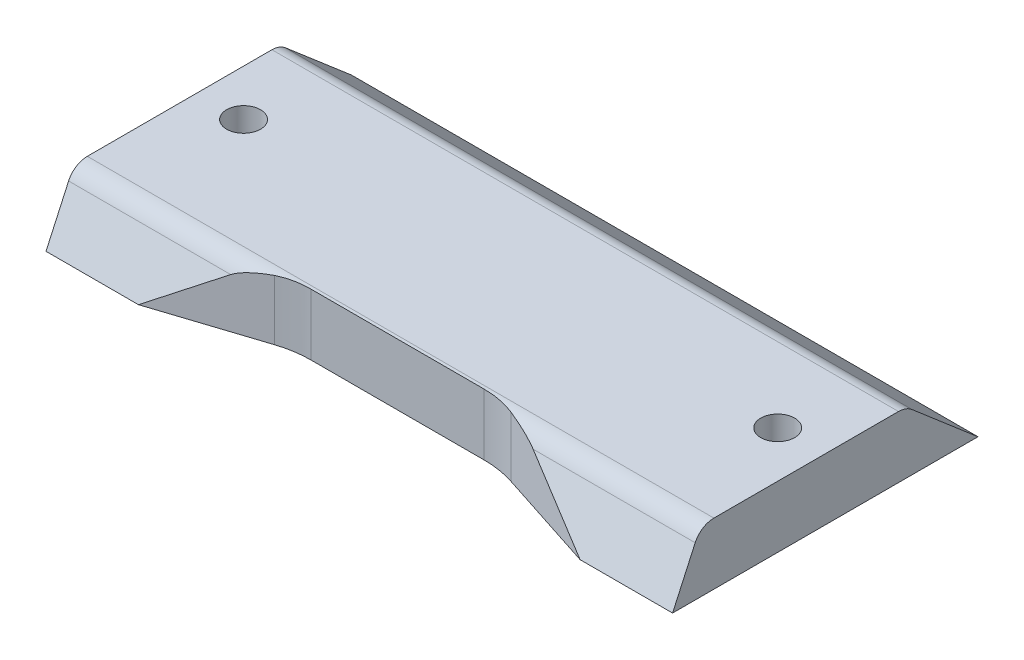
from build123d import *

# Parameters (mm, degrees)
SKETCH1_R                      = 10.999999999999991
SKETCH1_R_2                    = 1.5500000000000034
SKETCH1_R_3                    = 1.5500000000000018
SKETCH1_R_4                    = 1.5499999999999992
SKETCH1_R_5                    = 1.5500000000000012
BOSS_EXTRUDE1_DEPTH            = 2.8
SKETCH2_R                      = 1.5499999999999992
SKETCH2_R_2                    = 1.5500000000000005
SKETCH2_R_3                    = 1.5500000000000034
SKETCH2_R_4                    = 1.5500000000000018
BOSS_EXTRUDE2_DEPTH            = 8
SKETCH3_R                      = 2.75
SKETCH3_R_2                    = 2.749999999999998
SKETCH3_R_3                    = 2.7500000000000044
SKETCH3_R_4                    = 2.7500000000000036
CUT_EXTRUDE1_DEPTH             = 3.6
SKETCH4_W                      = 13.999999999999996
SKETCH4_H                      = 24
BOSS_EXTRUDE3_DEPTH            = 9
CUT_EXTRUDE3_DEPTH             = 92.05990830217213
CHAMFER1_SIZE                  = 2.4
BOSS_EXTRUDE4_START            = -21.5
BOSS_EXTRUDE4_DEPTH            = 43
SKETCH5_R                      = 1.6499999999999986
SKETCH5_R_2                    = 1.6500000000000061
CUT_EXTRUDE2_DEPTH             = 18
CUT_EXTRUDE4_DEPTH             = 2.8
CHAMFER2_SIZE                  = 1
CHAMFER3_SIZE                  = 1
FILLET1_R                      = 2
CHAMFER4_SIZE                  = 2
CHAMFER5_SIZE                  = 0.4
CHAMFER6_SIZE                  = 0.4
CUT_EXTRUDE6_REACH             = 93.06
CUT_EXTRUDE6_DIRECTION_2_DEPTH = 92.05990830217215
CUT_EXTRUDE5_DEPTH             = 92.05990830217213
CUT_EXTRUDE5_DEPTH_BACK        = 92.05990830217213
FILLET2_R                      = 10


# Read off the part's stored shape, not the designer's step: Mirror1
with BuildPart() as part:
    # Sketch1 → Boss-Extrude1 (new body)
    with BuildSketch(Plane.XY):
        Polygon((-21.499999999999996, 51), (21.499999999999996, 51), (21.5, 8), (-21.5, 8), align=None)
        with Locations((0, 29.5)):
            Circle(SKETCH1_R, mode=Mode.SUBTRACT)
        with Locations((-15.5, 45)):
            Circle(SKETCH1_R_2, mode=Mode.SUBTRACT)
        with Locations((15.5, 45)):
            Circle(SKETCH1_R_3, mode=Mode.SUBTRACT)
        with Locations((-15.5, 14.000000000000005)):
            Circle(SKETCH1_R_4, mode=Mode.SUBTRACT)
        with Locations((15.5, 14.000000000000005)):
            Circle(SKETCH1_R_5, mode=Mode.SUBTRACT)
    extrude(amount=BOSS_EXTRUDE1_DEPTH)

    # Sketch2 → Boss-Extrude2 (add)
    with BuildSketch(Plane(origin=(0, 0, 0), x_dir=(1, 0, 0), z_dir=(0, 1, 0))):
        with BuildLine():
            Line((-21.5, 0), (21.5, 0))
            Line((21.5, 0), (21.5, -56.13000000000001))
            Line((21.5, -56.13000000000001), (12.052422437019597, -62.83770289976113))
            ThreePointArc((12.052422437019597, -62.83770289976113), (10.126743955166411, -63.79910489864743), (8.000000000000245, -64.12999999999994))
            Line((8.000000000000245, -64.12999999999994), (-7.999999999999807, -64.13))
            ThreePointArc((-7.999999999999807, -64.13), (-10.126743955165974, -63.7991048986475), (-12.052422437019167, -62.83770289976122))
            Line((-12.052422437019167, -62.83770289976122), (-21.49999999999961, -56.13000000000015))
            Line((-21.49999999999961, -56.13000000000015), (-21.5, 0))
        make_face()
        with Locations(Location((8.00000000000003, -8.800000000000002, 0), (0, 0, 270))):
            Circle(SKETCH2_R, mode=Mode.SUBTRACT)
        with Locations(Location((-7.999999999999971, -8.800000000000054, 0), (0, 0, 270))):
            Circle(SKETCH2_R_2, mode=Mode.SUBTRACT)
        with Locations(Location((-7.999999999999804, -57.13000000000005, 0), (0, 0, 270))):
            Circle(SKETCH2_R_3, mode=Mode.SUBTRACT)
        with Locations(Location((8.000000000000195, -57.13, 0), (0, 0, 270))):
            Circle(SKETCH2_R_4, mode=Mode.SUBTRACT)
        with BuildLine():
            Line((15.912505911952584, -21.89324240011998), (3.312505911952694, -31.19069648889579))
            ThreePointArc((3.312505911952694, -31.19069648889579), (2.5001050442102857, -32.779502053609654), (3.2797696996303043, -34.38462551224556))
            Line((3.2797696996303043, -34.38462551224556), (15.87976969963019, -44.08717142346975))
            ThreePointArc((15.87976969963019, -44.08717142346975), (17.983045695097484, -44.297045925258715), (19.099999999999998, -42.50254591122421))
            Line((19.099999999999998, -42.50254591122421), (19.1, -23.50254591122421))
            ThreePointArc((19.1, -23.50254591122421), (18.001391098221283, -21.717190459767167), (15.912505911952584, -21.89324240011998))
        make_face(mode=Mode.SUBTRACT)
        with BuildLine():
            Line((10.520825659408167, -19.409303511104177), (1.1874940880475682, -26.2963052396794))
            ThreePointArc((1.1874940880475682, -26.2963052396794), (9.102e-14, -26.687001728575183), (-1.1874940880473879, -26.296305239679405))
            Line((-1.1874940880473879, -26.296305239679405), (-10.520825659408036, -19.40930351110425))
            ThreePointArc((-10.520825659408036, -19.40930351110425), (-11.233148275967746, -17.17494281149982), (-9.333331571360638, -15.800000000000061))
            Line((-9.333331571360638, -15.800000000000061), (9.333331571360745, -15.799999999999999))
            ThreePointArc((9.333331571360745, -15.799999999999999), (11.233148275967867, -17.17494281149974), (10.520825659408167, -19.409303511104177))
        make_face(mode=Mode.SUBTRACT)
        with BuildLine():
            Line((1.2202303003699406, -39.36175579272474), (10.553561871730695, -46.548825481280836))
            ThreePointArc((10.553561871730695, -46.548825481280836), (11.226642299225048, -48.77794652318848), (9.333331571360894, -50.13345099352635))
            Line((9.333331571360894, -50.13345099352635), (-9.33333157136048, -50.133450993526345))
            ThreePointArc((-9.33333157136048, -50.133450993526345), (-11.226642299224643, -48.7779465231885), (-10.553561871730299, -46.548825481280836))
            Line((-10.553561871730299, -46.548825481280836), (-1.2202303003696755, -39.36175579272474))
            ThreePointArc((-1.2202303003696755, -39.36175579272474), (1.3436e-13, -38.946381304970274), (1.2202303003699406, -39.36175579272474))
        make_face(mode=Mode.SUBTRACT)
        with BuildLine():
            Line((-3.2797696996300685, -34.384625512245584), (-15.879769699629884, -44.087171423469854))
            ThreePointArc((-15.879769699629884, -44.087171423469854), (-17.98304569509718, -44.297045925258836), (-19.099999999999707, -42.50254591122434))
            Line((-19.099999999999707, -42.50254591122434), (-19.099999999999834, -23.502545911224342))
            ThreePointArc((-19.099999999999834, -23.502545911224342), (-18.00139109822113, -21.71719045976729), (-15.912505911952431, -21.893242400120087))
            Line((-15.912505911952431, -21.893242400120087), (-3.31250591195248, -31.190696488895814))
            ThreePointArc((-3.31250591195248, -31.190696488895814), (-2.500105044210054, -32.779502053609676), (-3.2797696996300685, -34.384625512245584))
        make_face(mode=Mode.SUBTRACT)
    extrude(amount=BOSS_EXTRUDE2_DEPTH)

    # Sketch3 → Cut-Extrude1 (cut)
    with BuildSketch(Plane(origin=(0, 8, 0), x_dir=(1, 0, 0), z_dir=(0, 1, 0))):
        with Locations(Location((-7.999999999999971, -8.800000000000054, 0), (0, 0, 270))):
            Circle(SKETCH3_R)
        with Locations(Location((8.00000000000003, -8.800000000000002, 0), (0, 0, 270))):
            Circle(SKETCH3_R_2)
        with Locations(Location((-7.999999999999804, -57.13000000000005, 0), (0, 0, 270))):
            Circle(SKETCH3_R_3)
        with Locations(Location((8.000000000000195, -57.13, 0), (0, 0, 270))):
            Circle(SKETCH3_R_4)
    extrude(amount=-CUT_EXTRUDE1_DEPTH, mode=Mode.SUBTRACT)

    # Sketch4 → Boss-Extrude3 (add)
    # profile 1 of 2: a face of its own
    with BuildSketch(Plane(origin=(21.5, 1.73e-15, 0), x_dir=(0, 0, -1), z_dir=(1, 0, 0))):
        Polygon((-2.8, 8), (-2.8, 51), (-6.800000000000001, 51), (-13.799999999999999, 56.99999999999999), (-33.8, 57), (-56.13000000000001, 8.000000000000007), align=None)
        with Locations((-21.79999999999999, 26.999999999999993)):
            Rectangle(SKETCH4_W, SKETCH4_H, mode=Mode.SUBTRACT)
    # profile 2 of 2: a face of its own
    with BuildSketch(Plane(origin=(21.5, 1.73e-15, 0), x_dir=(0, 0, -1), z_dir=(1, 0, 0))):
        Polygon((0, 51), (-2.8, 51), (-2.8, 8), (-56.13000000000001, 8.000000000000007), (-56.13000000000001, 0), (0, 0), align=None)
    extrude(amount=BOSS_EXTRUDE3_DEPTH)

    # Sketch6 → Cut-Extrude3 (cut, through all)
    with BuildSketch(Plane.XZ):
        with BuildLine():
            Line((30.5, 56.13000000000001), (21.5, 56.13000000000001))
            Line((21.5, 56.13000000000001), (27.131339928022157, 52.13179464916522))
            ThreePointArc((27.131339928022157, 52.13179464916522), (29.60811928094123, 49.27948759313254), (30.5, 45.60870562086678))
            Line((30.5, 45.60870562086678), (30.5, 56.13000000000001))
        make_face()
    extrude(amount=-CUT_EXTRUDE3_DEPTH, mode=Mode.SUBTRACT)

    # Chamfer1
    # the kernel refuses this chamfer: 2.4 mm, written as the material it adds along each edge
    with BuildSketch(Plane(origin=(21.5, 8, 2.8), x_dir=(-0.9996219169112968, -0.027495876610586303, 0), z_dir=(0, 0, 1))) as chamfer1_piece_1_section:
        Polygon((CHAMFER1_SIZE * 0.999621916911, -CHAMFER1_SIZE * 0.0274958766106), (-CHAMFER1_SIZE * 0.0274958766106, -CHAMFER1_SIZE * 0.999621916911), (0, 0), align=None)
    chamfer1_piece_1 = extrude(amount=59.502039171118206, mode=Mode.PRIVATE)
    chamfer1_piece_1 = split(chamfer1_piece_1, bisect_by=Plane(origin=(20.6986233607906, 18.79069033848495, 51.212528260033295), z_dir=(0, -0.4146842236388121, -0.9099653810256058)), keep=Keep.TOP, mode=Mode.PRIVATE)
    add(chamfer1_piece_1)

    # Mirror1: part across plane


with BuildPart() as part_1:
    add(part.part)
    add(part.part.mirror(Plane(origin=(0, 0, 0), x_dir=(0, 0, 1), z_dir=(1, 0, 0))))

    # Sketch7 → Boss-Extrude4 (add)
    with BuildSketch(Plane(origin=(0, 0, 0), x_dir=(0, 0, -1), z_dir=(1, 0, 0)).offset(BOSS_EXTRUDE4_START)):
        Polygon((-36.53428571428571, 50.99999999999999), (-6.800000000000001, 51), (-13.799999999999999, 56.99999999999999), (-33.8, 57), align=None)
    extrude(amount=BOSS_EXTRUDE4_DEPTH)

    # Sketch5 → Cut-Extrude2 (cut)
    with BuildSketch(Plane(origin=(0, 56.999999999999986, -1.978e-14), x_dir=(1, 0, 0), z_dir=(0, 1, 0))):
        with Locations(Location((26, -21.8, 0), (0, 0, 270))):
            Circle(SKETCH5_R)
        with Locations(Location((-26, -21.8, 0), (0, 0, 270))):
            Circle(SKETCH5_R_2)
    extrude(amount=-CUT_EXTRUDE2_DEPTH, mode=Mode.SUBTRACT)

    # Sketch9 → Cut-Extrude4 (cut)
    with BuildSketch(Plane.XZ.offset(-38.99999999999999)):
        Polygon((26, 18.566838492538096), (28.800000000000004, 20.183419246269047), (28.800000000000008, 23.416580753730955), (26.00000000000001, 25.03316150746191), (23.200000000000003, 23.416580753730955), (23.2, 20.18341924626905), align=None)
        Polygon((-26, 18.566838492538096), (-28.800000000000004, 20.183419246269047), (-28.800000000000008, 23.416580753730955), (-26.00000000000001, 25.03316150746191), (-23.200000000000003, 23.416580753730955), (-23.2, 20.18341924626905), align=None)
    extrude(amount=-CUT_EXTRUDE4_DEPTH, mode=Mode.SUBTRACT)

    # Chamfer2
    chamfer2_edges = [part_1.edges().sort_by_distance(p)[0] for p in [
        (30.5, 1.73e-15, 22.804352810433386),
        (29.60811928094123, 0, 49.27948759313254),
        (-30.5, 1.73e-15, 22.804352810433386),
        (-29.60811928094123, 0, 49.27948759313254),
        (-10.12674395516598, 8, 63.7991048986475),
        (2.1849e-13, 0, 64.12999999999997),
        (10.126743955166415, 0, 63.79910489864743),
        (19.59188118252077, 0, 57.4847487744632),
        (-16.77621121850939, 8, 59.48385144988068),
        (-10.12674395516598, 0, 63.7991048986475),
        (-19.59188118252077, 0, 57.4847487744632),
        (2.1849e-13, 8, 64.12999999999997),
        (10.126743955166415, 8, 63.79910489864743),
        (16.7762112185098, 8, 59.483851449880575),
    ]]
    chamfer(chamfer2_edges, length=CHAMFER2_SIZE)

    # Chamfer3
    chamfer3_edges = [part_1.edges().sort_by_distance(p)[0] for p in [
        (30.5, 51, 3.4000000000000004),
        (-30.5, 51, 3.4000000000000004),
    ]]
    chamfer(chamfer3_edges, length=CHAMFER3_SIZE)

    # Fillet1
    fillet1_edges = [part_1.edges().sort_by_distance(p)[0] for p in [
        (0, 57, 33.8),
        (0, 56.99999999999999, 13.799999999999999),
    ]]
    fillet(fillet1_edges, radius=FILLET1_R)

    # Chamfer4
    chamfer4_edges = [part_1.edges().sort_by_distance(p)[0] for p in [
        (30.5, 26.999999999999993, 14.799999999999994),
        (30.5, 14.999999999999995, 21.799999999999994),
        (26, 14.999999999999995, 14.799999999999994),
        (30.5, 26.999999999999993, 28.799999999999994),
        (26, 14.999999999999995, 28.799999999999994),
        (21.5, 26.999999999999993, 28.799999999999994),
        (21.5, 14.999999999999995, 21.799999999999994),
        (21.5, 26.999999999999993, 14.799999999999994),
        (-21.5, 26.999999999999993, 28.799999999999994),
        (-21.5, 14.999999999999995, 21.799999999999994),
        (-26, 14.999999999999995, 28.799999999999994),
        (-21.5, 26.999999999999993, 14.799999999999994),
        (-26, 14.999999999999995, 14.799999999999994),
        (-30.5, 26.999999999999993, 28.799999999999994),
        (-30.5, 14.999999999999995, 21.799999999999994),
        (-30.5, 26.999999999999993, 14.799999999999994),
    ]]
    chamfer(chamfer4_edges, length=CHAMFER4_SIZE)

    # Chamfer5
    chamfer5_edges = [part_1.edges().sort_by_distance(p)[0] for p in [
        (-10.999999999999993, 29.500000000000007, 2.8),
    ]]
    chamfer(chamfer5_edges, length=CHAMFER5_SIZE)

    # Chamfer6
    chamfer6_edges = [part_1.edges().sort_by_distance(p)[0] for p in [
        (8.00000000000003, 8, 6.050000000000004),
        (-7.999999999999802, 8, 54.380000000000045),
        (8.000000000000195, 8, 54.379999999999995),
        (-7.999999999999969, 8, 6.050000000000054),
    ]]
    chamfer(chamfer6_edges, length=CHAMFER6_SIZE)

    # Cut-Extrude6: up to this face of the body (flat: up to its plane)
    cut_extrude6_end = Plane(part_1.part.faces().sort_by_distance((0, 51, 21.667142857))[0])
    # Sketch10 → Cut-Extrude6 (cut, up to the picked face)
    with BuildSketch(Plane(origin=(0, 56.999999999999986, -1.978e-14), x_dir=(1, 0, 0), z_dir=(0, 1, 0)), mode=Mode.PRIVATE) as cut_extrude6_sk1:
        Polygon((21.499999999999964, -36.53428571428573), (10, -32.79999999999994), (-10, -32.79999999999994), (-21.499999999999964, -36.53428571428573), align=None)
    cut_extrude6_tool1 = split(extrude(cut_extrude6_sk1.sketch, amount=-CUT_EXTRUDE6_REACH, mode=Mode.PRIVATE), bisect_by=cut_extrude6_end, keep=Keep.BOTH, mode=Mode.PRIVATE)
    add(cut_extrude6_tool1.solids().sort_by(Axis((0, 57, 34.894361), (0, -1, 0)))[0], mode=Mode.SUBTRACT)

    # Sketch10 → Cut-Extrude6 direction 2 (cut)
    with BuildSketch(Plane(origin=(0, 56.999999999999986, -1.978e-14), x_dir=(1, 0, 0), z_dir=(0, 1, 0))):
        Polygon((21.499999999999964, -36.53428571428573), (10, -32.79999999999994), (-10, -32.79999999999994), (-21.499999999999964, -36.53428571428573), align=None)
    extrude(amount=CUT_EXTRUDE6_DIRECTION_2_DEPTH, mode=Mode.SUBTRACT)

    # Sketch8 → Cut-Extrude5 (cut, two sides: drawn at the far end of the back side and taken through both)
    with BuildSketch(Plane(origin=(0, 0, 0), x_dir=(0, 0, -1), z_dir=(1, 0, 0)).offset(-CUT_EXTRUDE5_DEPTH_BACK)):
        Polygon((-6.800000000000001, 51), (-200, 50.99999999999998), (-200, 48.99999999999997), (-6.800000000000001, 48.99999999999999), align=None)
        Polygon((0, 51), (-6.800000000000001, 51), (-6.800000000000001, 48.99999999999999), (-200, 48.99999999999997), (-200, -2.449e-14), (0, 0), align=None)
    extrude(amount=CUT_EXTRUDE5_DEPTH + CUT_EXTRUDE5_DEPTH_BACK, mode=Mode.SUBTRACT)

    # Fillet2
    fillet2_edges = [part_1.edges().sort_by_distance(p)[0] for p in [
        (-10, 53.98968962932255, 32.79999999999992),
        (10, 53.98968962932255, 32.79999999999992),
    ]]
    fillet(fillet2_edges, radius=FILLET2_R)


solid = part_1.part
